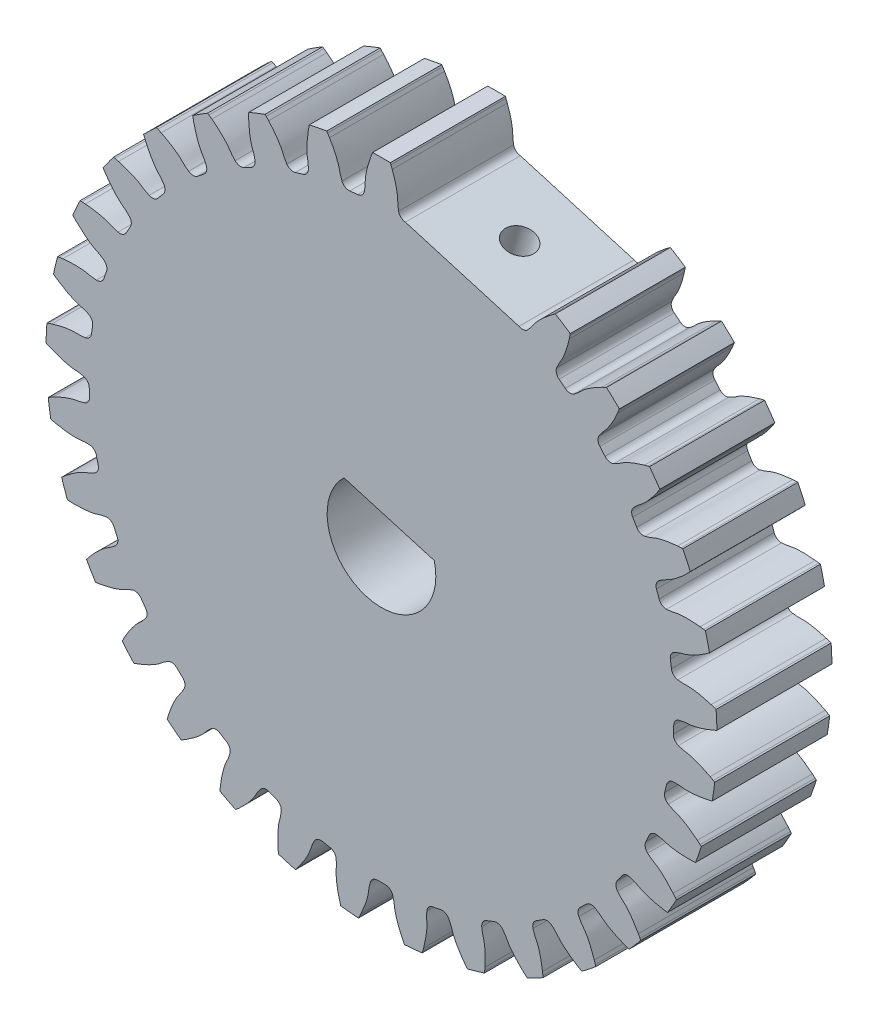
from build123d import *

# Parameters (mm, degrees)
BOSS_EXTRUDE1_DEPTH = 6.35
CUT_EXTRUDE1_REACH  = 43.23
SKETCH2_R           = 0.80645


with BuildPart() as part:
    # Sketch1 → Boss-Extrude1 (new body)
    with BuildSketch(Plane.XY):
        with BuildLine():
            Line((1.317722718, 16.087824145), (7.589195505, 14.246353585))
            ThreePointArc((7.589195505, 14.246353585), (7.848909294, 14.203144005), (8.081908957, 14.325738774))
            add(Edge.make_bspline(
                [(8.081908957, 14.325738774), (8.135763516, 14.382193351), (8.188276052, 14.439723268), (8.286040148, 14.560601191), (8.329833372, 14.625117736), (8.41657454, 14.754828132), (8.460564791, 14.819186802), (8.558645399, 14.93981111), (8.611251956, 14.997265689), (8.880827661, 15.279295862), (9.114602467, 15.484439301), (9.364156602, 15.671733637)],
                knots=[0, 0, 0, 0, 0.125, 0.125, 0.25, 0.25, 0.375, 0.375, 0.5, 0.5, 1, 1, 1, 1], degree=3))
            add(Edge.make_bspline(
                [(9.524985691, 15.789047753), (9.480902248, 15.75776951), (9.422419075, 15.715460547), (9.364156602, 15.671733637)],
                knots=[0.5, 0.5, 0.5, 0.5, 1, 1, 1, 1], degree=3))
            add(Edge.make_bspline(
                [(9.597666219, 15.840014852), (9.569069134, 15.820325996), (9.524985691, 15.789047753)],
                knots=[0, 0, 0, 0.5, 0.5, 0.5], degree=2))
            ThreePointArc((9.597666219, 15.840014852), (10.013118473, 15.580716473), (10.421569679, 15.310524249))
            add(Edge.make_bspline(
                [(10.421569679, 15.310524249), (10.415539725, 15.276332379), (10.405400958, 15.223239217)],
                knots=[0, 0, 0, 0.5, 0.5, 0.5], degree=2))
            add(Edge.make_bspline(
                [(10.405400958, 15.223239217), (10.395262191, 15.170146055), (10.381071393, 15.099372112), (10.365499102, 15.028209887)],
                knots=[0.5, 0.5, 0.5, 0.5, 1, 1, 1, 1], degree=3))
            add(Edge.make_bspline(
                [(10.365499102, 15.028209887), (10.298797583, 14.723397404), (10.209249565, 14.425372226), (10.064716198, 14.063080733), (10.034311357, 13.991375238), (9.965335513, 13.852067605), (9.925065558, 13.785319161), (9.843110552, 13.652533336), (9.802619615, 13.585895932), (9.733288872, 13.44676663), (9.702778631, 13.375114097), (9.673804032, 13.30268993)],
                knots=[0, 0, 0, 0, 0.5, 0.5, 0.625, 0.625, 0.75, 0.75, 0.875, 0.875, 1, 1, 1, 1], degree=3))
            ThreePointArc((9.673804032, 13.30268993), (9.659079466, 13.039818274), (9.806273289, 12.82152421))
            ThreePointArc((9.806273289, 12.82152421), (9.978136908, 12.68823324), (10.148188999, 12.552638724))
            ThreePointArc((10.148188999, 12.552638724), (10.395031955, 12.46105884), (10.647022223, 12.537342685))
            add(Edge.make_bspline(
                [(10.647022223, 12.537342685), (10.710587659, 12.582585012), (10.773038833, 12.629137225), (10.891912502, 12.729328749), (10.947124161, 12.784391475), (11.056845658, 12.895341961), (11.112220906, 12.950212376), (11.23135737, 13.050094969), (11.293886608, 13.096555413), (11.61196529, 13.322471395), (11.880339132, 13.479665452), (12.160829185, 13.616346705)],
                knots=[0, 0, 0, 0, 0.125, 0.125, 0.25, 0.25, 0.375, 0.375, 0.5, 0.5, 1, 1, 1, 1], degree=3))
            add(Edge.make_bspline(
                [(12.340953725, 13.701103697), (12.291747481, 13.678733539), (12.226314152, 13.648257167), (12.160829185, 13.616346705)],
                knots=[0.5, 0.5, 0.5, 0.5, 1, 1, 1, 1], degree=3))
            add(Edge.make_bspline(
                [(12.421966409, 13.737394873), (12.39015997, 13.723473855), (12.340953725, 13.701103697)],
                knots=[0, 0, 0, 0.5, 0.5, 0.5], degree=2))
            ThreePointArc((12.421966409, 13.737394873), (12.780838358, 13.404157497), (13.130774104, 13.061548101))
            add(Edge.make_bspline(
                [(13.130774104, 13.061548101), (13.118382265, 13.029115299), (13.098378772, 12.978900373)],
                knots=[0, 0, 0, 0.5, 0.5, 0.5], degree=2))
            add(Edge.make_bspline(
                [(13.098378772, 12.978900373), (13.078375279, 12.928685448), (13.05104687, 12.861876109), (13.022288452, 12.794946953)],
                knots=[0.5, 0.5, 0.5, 0.5, 1, 1, 1, 1], degree=3))
            add(Edge.make_bspline(
                [(13.022288452, 12.794946953), (12.899106174, 12.508266174), (12.754774769, 12.232573774), (12.544289193, 11.904182479), (12.500863453, 11.839526949), (12.40676995, 11.715790551), (12.354595499, 11.657869478), (12.248991644, 11.542993353), (12.19662122, 11.485223133), (12.102212979, 11.361729009), (12.058693767, 11.297145431), (12.016536413, 11.231513542)],
                knots=[0, 0, 0, 0, 0.5, 0.5, 0.625, 0.625, 0.75, 0.75, 0.875, 0.875, 1, 1, 1, 1], degree=3))
            ThreePointArc((12.016536413, 11.231513542), (11.952329151, 10.976178962), (12.055550567, 10.733973142))
            ThreePointArc((12.055550567, 10.733973142), (12.199082904, 10.570565509), (12.340400502, 10.405238793))
            ThreePointArc((12.340400502, 10.405238793), (12.565451077, 10.26859854), (12.827324365, 10.295814365))
            add(Edge.make_bspline(
                [(12.827324365, 10.295814365), (12.898303258, 10.328209266), (12.968435922, 10.362101258), (13.10412276, 10.437985201), (13.168757362, 10.481603996), (13.297493565, 10.569784533), (13.362252405, 10.613183534), (13.498138823, 10.688714394), (13.568330773, 10.722501501), (13.92341624, 10.8841381), (14.216689388, 10.987701373), (14.517977717, 11.068829526)],
                knots=[0, 0, 0, 0, 0.125, 0.125, 0.25, 0.25, 0.375, 0.375, 0.5, 0.5, 1, 1, 1, 1], degree=3))
            add(Edge.make_bspline(
                [(14.710887538, 11.117966055), (14.658336935, 11.105312498), (14.58831838, 11.087770213), (14.517977717, 11.068829526)],
                knots=[0.5, 0.5, 0.5, 0.5, 1, 1, 1, 1], degree=3))
            add(Edge.make_bspline(
                [(14.797304367, 11.138269651), (14.763438142, 11.130619612), (14.710887538, 11.117966055)],
                knots=[0, 0, 0, 0.5, 0.5, 0.5], degree=2))
            ThreePointArc((14.797304367, 11.138269651), (15.086625445, 10.743137346), (15.365398141, 10.340493572))
            add(Edge.make_bspline(
                [(15.365398141, 10.340493572), (15.347092291, 10.310992044), (15.31794705, 10.265470254)],
                knots=[0, 0, 0, 0.5, 0.5, 0.5], degree=2))
            add(Edge.make_bspline(
                [(15.31794705, 10.265470254), (15.288801809, 10.219948464), (15.24932351, 10.159518391), (15.208418367, 10.0992413)],
                knots=[0.5, 0.5, 0.5, 0.5, 1, 1, 1, 1], degree=3))
            add(Edge.make_bspline(
                [(15.208418367, 10.0992413), (15.03320746, 9.841053615), (14.839309181, 9.597658233), (14.570478893, 9.315036054), (14.515601773, 9.259767309), (14.399791394, 9.156074302), (14.337598169, 9.109074018), (14.212162263, 9.016259514), (14.149805155, 8.969444446), (14.033731578, 8.866048899), (13.978776292, 8.810868495), (13.924959859, 8.754400992)],
                knots=[0, 0, 0, 0, 0.5, 0.5, 0.625, 0.625, 0.75, 0.75, 0.875, 0.875, 1, 1, 1, 1], degree=3))
            ThreePointArc((13.924959859, 8.754400992), (13.813590519, 8.515831944), (13.869108836, 8.258468317))
            ThreePointArc((13.869108836, 8.258468317), (13.97912226, 8.070849999), (14.086597777, 7.881766421))
            ThreePointArc((14.086597777, 7.881766421), (14.281722058, 7.705004334), (14.544013583, 7.682168489))
            add(Edge.make_bspline(
                [(14.544013583, 7.682168489), (14.619840571, 7.700545128), (14.695119948, 7.720551954), (14.842715878, 7.769385672), (14.91443736, 7.79998404), (15.057535409, 7.862207553), (15.129337287, 7.892566586), (15.277062369, 7.941015831), (15.352380112, 7.960908447), (15.731638649, 8.052423697), (16.039211447, 8.098613138), (16.350408708, 8.121256008)],
                knots=[0, 0, 0, 0, 0.125, 0.125, 0.25, 0.25, 0.375, 0.375, 0.5, 0.5, 1, 1, 1, 1], degree=3))
            add(Edge.make_bspline(
                [(16.549131547, 8.132996152), (16.495135899, 8.130516528), (16.423062772, 8.126542354), (16.350408708, 8.121256008)],
                knots=[0.5, 0.5, 0.5, 0.5, 1, 1, 1, 1], degree=3))
            add(Edge.make_bspline(
                [(16.637829192, 8.136578344), (16.603127194, 8.135475776), (16.549131547, 8.132996152)],
                knots=[0, 0, 0, 0.5, 0.5, 0.5], degree=2))
            ThreePointArc((16.637829192, 8.136578344), (16.847142581, 7.69383222), (17.044676656, 7.245706664))
            add(Edge.make_bspline(
                [(17.044676656, 7.245706664), (17.021118415, 7.220202672), (16.983884811, 7.181019293)],
                knots=[0, 0, 0, 0.5, 0.5, 0.5], degree=2))
            add(Edge.make_bspline(
                [(16.983884811, 7.181019293), (16.946651207, 7.141835914), (16.896449866, 7.089969209), (16.844876418, 7.038522752)],
                knots=[0.5, 0.5, 0.5, 0.5, 1, 1, 1, 1], degree=3))
            add(Edge.make_bspline(
                [(16.844876418, 7.038522752), (16.623969459, 6.818159737), (16.387512296, 6.615858318), (16.070053522, 6.389219956), (16.005708425, 6.345335553), (15.87236686, 6.265433671), (15.802402685, 6.231052889), (15.661668309, 6.163654566), (15.591578265, 6.129486667), (15.458034552, 6.049926681), (15.39362942, 6.006143816), (15.330098975, 5.96088158)],
                knots=[0, 0, 0, 0, 0.5, 0.5, 0.625, 0.625, 0.75, 0.75, 0.875, 0.875, 1, 1, 1, 1], degree=3))
            ThreePointArc((15.330098975, 5.96088158), (15.175592735, 5.747700572), (15.181401378, 5.484480931))
            ThreePointArc((15.181401378, 5.484480931), (15.253919716, 5.279432943), (15.323668708, 5.073426476))
            ThreePointArc((15.323668708, 5.073426476), (15.481814393, 4.862931198), (15.735044257, 4.790869028))
            add(Edge.make_bspline(
                [(15.735044257, 4.790869028), (15.812978754, 4.794563226), (15.890684051, 4.799961786), (16.044854573, 4.819980302), (16.121070733, 4.836452338), (16.273358691, 4.870469907), (16.349608501, 4.886691718), (16.503833078, 4.906308266), (16.581554433, 4.911587421), (16.971278649, 4.92967372), (17.282034615, 4.916819923), (17.591893328, 4.880159138)],
                knots=[0, 0, 0, 0, 0.125, 0.125, 0.25, 0.25, 0.375, 0.375, 0.5, 0.5, 1, 1, 1, 1], degree=3))
            add(Edge.make_bspline(
                [(17.789246823, 4.854078578), (17.735757675, 4.861862508), (17.664234886, 4.871600081), (17.591893328, 4.880159138)],
                knots=[0.5, 0.5, 0.5, 0.5, 1, 1, 1, 1], degree=3))
            add(Edge.make_bspline(
                [(17.87701952, 4.840809895), (17.84273597, 4.846294649), (17.789246823, 4.854078578)],
                knots=[0, 0, 0, 0.5, 0.5, 0.5], degree=2))
            ThreePointArc((17.87701952, 4.840809895), (17.998760088, 4.366451951), (18.107916146, 3.889041039))
            add(Edge.make_bspline(
                [(18.107916146, 3.889041039), (18.079956971, 3.868456363), (18.035980724, 3.837027585)],
                knots=[0, 0, 0, 0.5, 0.5, 0.5], degree=2))
            add(Edge.make_bspline(
                [(18.035980724, 3.837027585), (17.992004477, 3.805598806), (17.9328945, 3.764170067), (17.872516746, 3.723413653)],
                knots=[0.5, 0.5, 0.5, 0.5, 1, 1, 1, 1], degree=3))
            add(Edge.make_bspline(
                [(17.872516746, 3.723413653), (17.613897889, 3.548839802), (17.34342802, 3.394944045), (16.988814547, 3.232480802), (16.917327071, 3.201566837), (16.771273632, 3.148343943), (16.696067195, 3.127825274), (16.545120856, 3.088279082), (16.469831113, 3.06799327), (16.323643883, 3.01514435), (16.252116674, 2.984341449), (16.181168372, 2.951920377)],
                knots=[0, 0, 0, 0, 0.5, 0.5, 0.625, 0.625, 0.75, 0.75, 0.875, 0.875, 1, 1, 1, 1], degree=3))
            ThreePointArc((16.181168372, 2.951920377), (15.98910949, 2.771832327), (15.944998519, 2.512270114))
            ThreePointArc((15.944998519, 2.512270114), (15.977400768, 2.297203425), (16.006902326, 2.08171968))
            ThreePointArc((16.006902326, 2.08171968), (16.122353619, 1.845099057), (16.357369434, 1.726415078))
            add(Edge.make_bspline(
                [(16.357369434, 1.726415078), (16.434594684, 1.715293316), (16.51191743, 1.705888493), (16.667090418, 1.696368285), (16.745046606, 1.698118647), (16.90102039, 1.702700789), (16.978962264, 1.704199079), (17.134112258, 1.694273938), (17.211428174, 1.684748828), (17.597532421, 1.628752491), (17.900240025, 1.557320026), (18.197561087, 1.462680602)],
                knots=[0, 0, 0, 0, 0.125, 0.125, 0.25, 0.25, 0.375, 0.375, 0.5, 0.5, 1, 1, 1, 1], degree=3))
            add(Edge.make_bspline(
                [(18.386412369, 1.399721958), (18.335362958, 1.417488109), (18.266975527, 1.440585489), (18.197561087, 1.462680602)],
                knots=[0.5, 0.5, 0.5, 0.5, 1, 1, 1, 1], degree=3))
            add(Edge.make_bspline(
                [(18.470087785, 1.370081964), (18.437461779, 1.381955806), (18.386412369, 1.399721958)],
                knots=[0, 0, 0, 0.5, 0.5, 0.5], degree=2))
            ThreePointArc((18.470087785, 1.370081964), (18.499855511, 0.881256733), (18.516688368, 0.391815337))
            add(Edge.make_bspline(
                [(18.516688368, 0.391815337), (18.485338776, 0.376893962), (18.436209301, 0.354355702)],
                knots=[0, 0, 0, 0.5, 0.5, 0.5], degree=2))
            add(Edge.make_bspline(
                [(18.436209301, 0.354355702), (18.387079826, 0.331817442), (18.321197604, 0.302324011), (18.254197752, 0.273730684)],
                knots=[0.5, 0.5, 0.5, 0.5, 1, 1, 1, 1], degree=3))
            add(Edge.make_bspline(
                [(18.254197752, 0.273730684), (17.967214156, 0.15125555), (17.672507066, 0.051327649), (17.29355555, -0.041088631), (17.21750944, -0.057914846), (17.064022878, -0.082535137), (16.986292335, -0.088450096), (16.830589627, -0.098714854), (16.752821353, -0.104385398), (16.599274193, -0.128613154), (16.523210086, -0.145322792), (16.447408185, -0.163730919)],
                knots=[0, 0, 0, 0, 0.5, 0.5, 0.625, 0.625, 0.75, 0.75, 0.875, 0.875, 1, 1, 1, 1], degree=3))
            ThreePointArc((16.447408185, -0.163730919), (16.224738169, -0.304217162), (16.132301868, -0.550740691))
            ThreePointArc((16.132301868, -0.550740691), (16.123416929, -0.768053011), (16.111604787, -0.985225891))
            ThreePointArc((16.111604787, -0.985225891), (16.180188978, -1.239419771), (16.38849666, -1.400436011))
            add(Edge.make_bspline(
                [(16.38849666, -1.400436011), (16.462221543, -1.425971763), (16.536367091, -1.449840055), (16.686934191, -1.488554901), (16.763812867, -1.501589477), (16.917835177, -1.526608372), (16.994652093, -1.539887755), (17.14511998, -1.578995865), (17.219236057, -1.602980977), (17.58776552, -1.731036096), (17.871484121, -1.858465475), (18.145521576, -2.007663022)],
                knots=[0, 0, 0, 0, 0.125, 0.125, 0.25, 0.25, 0.375, 0.375, 0.5, 0.5, 1, 1, 1, 1], degree=3))
            add(Edge.make_bspline(
                [(18.319045067, -2.105224262), (18.272280452, -2.078118003), (18.209500078, -2.042495617), (18.145521576, -2.007663022)],
                knots=[0.5, 0.5, 0.5, 0.5, 1, 1, 1, 1], degree=3))
            add(Edge.make_bspline(
                [(18.395598953, -2.150164298), (18.365809682, -2.13233052), (18.319045067, -2.105224262)],
                knots=[0, 0, 0, 0.5, 0.5, 0.5], degree=2))
            ThreePointArc((18.395598953, -2.150164298), (18.332317955, -2.635789401), (18.256219227, -3.119571591))
            add(Edge.make_bspline(
                [(18.256219227, -3.119571591), (18.222612274, -3.128290368), (18.170105239, -3.141123518)],
                knots=[0, 0, 0, 0.5, 0.5, 0.5], degree=2))
            add(Edge.make_bspline(
                [(18.170105239, -3.141123518), (18.117598204, -3.153956668), (18.047324891, -3.170448823), (17.976124491, -3.185845626)],
                knots=[0.5, 0.5, 0.5, 0.5, 1, 1, 1, 1], degree=3))
            add(Edge.make_bspline(
                [(17.976124491, -3.185845626), (17.671148491, -3.251795471), (17.362855663, -3.294143862), (16.973262398, -3.313173013), (16.895406158, -3.315303336), (16.740033877, -3.310431183), (16.662588613, -3.301528649), (16.507757038, -3.282140979), (16.43032098, -3.272991305), (16.274963484, -3.267722243), (16.197111635, -3.26973469), (16.119195812, -3.273464554)],
                knots=[0, 0, 0, 0, 0.5, 0.5, 0.625, 0.625, 0.75, 0.75, 0.875, 0.875, 1, 1, 1, 1], degree=3))
            ThreePointArc((16.119195812, -3.273464554), (15.873962538, -3.36927145), (15.736541797, -3.593846292))
            ThreePointArc((15.736541797, -3.593846292), (15.686690793, -3.80555001), (15.633991875, -4.016562831))
            ThreePointArc((15.633991875, -4.016562831), (15.653230151, -4.27914274), (15.827300918, -4.476671694))
            add(Edge.make_bspline(
                [(15.827300918, -4.476671694), (15.894860823, -4.515698508), (15.963149361, -4.553167606), (16.103668684, -4.619677835), (16.176691252, -4.647026244), (16.323195322, -4.70074193), (16.396110916, -4.728319033), (16.536458394, -4.795196644), (16.604695885, -4.832774874), (16.94233095, -5.028260529), (17.196806217, -5.207081191), (17.437655637, -5.405444474)],
                knots=[0, 0, 0, 0, 0.125, 0.125, 0.25, 0.25, 0.375, 0.375, 0.5, 0.5, 1, 1, 1, 1], degree=3))
            add(Edge.make_bspline(
                [(17.589579747, -5.534082191), (17.548790122, -5.498615517), (17.493885853, -5.451755609), (17.437655637, -5.405444474)],
                knots=[0.5, 0.5, 0.5, 0.5, 1, 1, 1, 1], degree=3))
            add(Edge.make_bspline(
                [(17.656245247, -5.592698021), (17.630369371, -5.569548866), (17.589579747, -5.534082191)],
                knots=[0, 0, 0, 0.5, 0.5, 0.5], degree=2))
            ThreePointArc((17.656245247, -5.592698021), (17.502202663, -6.057571237), (17.335922757, -6.518209075))
            add(Edge.make_bspline(
                [(17.335922757, -6.518209075), (17.301273086, -6.520410135), (17.247286232, -6.523074351)],
                knots=[0, 0, 0, 0.5, 0.5, 0.5], degree=2))
            add(Edge.make_bspline(
                [(17.247286232, -6.523074351), (17.193299378, -6.525738568), (17.121174834, -6.528633375), (17.048347254, -6.530277174)],
                knots=[0.5, 0.5, 0.5, 0.5, 1, 1, 1, 1], degree=3))
            add(Edge.make_bspline(
                [(17.048347254, -6.530277174), (16.736401478, -6.537318132), (16.425665417, -6.52055643), (16.039511319, -6.46551069), (15.962658877, -6.452868125), (15.811016436, -6.418679621), (15.736655525, -6.395281354), (15.588291099, -6.346941976), (15.513985998, -6.323302779), (15.362433191, -6.288727336), (15.285607368, -6.275969856), (15.208393704, -6.26488665)],
                knots=[0, 0, 0, 0, 0.5, 0.5, 0.625, 0.625, 0.75, 0.75, 0.875, 0.875, 1, 1, 1, 1], degree=3))
            ThreePointArc((15.208393704, -6.26488665), (14.94946054, -6.312551488), (14.772022103, -6.507060925))
            ThreePointArc((14.772022103, -6.507060925), (14.683006779, -6.705504515), (14.59132576, -6.902730723))
            ThreePointArc((14.59132576, -6.902730723), (14.560522802, -7.164206339), (14.694065283, -7.391108799))
            add(Edge.make_bspline(
                [(14.694065283, -7.391108799), (14.753018419, -7.442216143), (14.812981821, -7.491931816), (14.938374633, -7.583833575), (15.004901868, -7.624507375), (15.138592658, -7.704978426), (15.204971572, -7.745856542), (15.330126116, -7.838086522), (15.39001874, -7.887899694), (15.684556396, -8.143750526), (15.900590931, -8.367499426), (16.09954739, -8.607859078)],
                knots=[0, 0, 0, 0, 0.125, 0.125, 0.25, 0.25, 0.375, 0.375, 0.5, 0.5, 1, 1, 1, 1], degree=3))
            add(Edge.make_bspline(
                [(16.224381185, -8.762923971), (16.191040795, -8.720378739), (16.145997012, -8.66397495), (16.09954739, -8.607859078)],
                knots=[0.5, 0.5, 0.5, 0.5, 1, 1, 1, 1], degree=3))
            add(Edge.make_bspline(
                [(16.278748834, -8.833097066), (16.257721575, -8.805469204), (16.224381185, -8.762923971)],
                knots=[0, 0, 0, 0.5, 0.5, 0.5], degree=2))
            ThreePointArc((16.278748834, -8.833097066), (16.039512166, -9.260416667), (15.78906087, -9.681261499))
            add(Edge.make_bspline(
                [(15.78906087, -9.681261499), (15.754620811, -9.67686529), (15.701105363, -9.669264281)],
                knots=[0, 0, 0, 0.5, 0.5, 0.5], degree=2))
            add(Edge.make_bspline(
                [(15.701105363, -9.669264281), (15.647589916, -9.661663272), (15.57622091, -9.650856107), (15.504398329, -9.63868749)],
                knots=[0.5, 0.5, 0.5, 0.5, 1, 1, 1, 1], degree=3))
            add(Edge.make_bspline(
                [(15.504398329, -9.63868749), (15.196757308, -9.586565083), (14.894808826, -9.511299101), (14.526050511, -9.384167965), (14.452979513, -9.357209447), (14.310547666, -9.294940254), (14.241958704, -9.257891929), (14.105423704, -9.182347954), (14.036935141, -9.145073616), (13.894664536, -9.082441439), (13.821641425, -9.05537512), (13.747920623, -9.02987942)],
                knots=[0, 0, 0, 0, 0.5, 0.5, 0.625, 0.625, 0.75, 0.75, 0.875, 0.875, 1, 1, 1, 1], degree=3))
            ThreePointArc((13.747920623, -9.02987942), (13.484646089, -9.027679469), (13.273603043, -9.185093422))
            ThreePointArc((13.273603043, -9.185093422), (13.148640646, -9.363104618), (13.021291117, -9.539415945))
            ThreePointArc((13.021291117, -9.539415945), (12.941560222, -9.790336857), (13.029747843, -10.038411973))
            add(Edge.make_bspline(
                [(13.029747843, -10.038411973), (13.077963491, -10.099752695), (13.127434523, -10.15991809), (13.233168801, -10.273889811), (13.290796236, -10.326418944), (13.406841812, -10.430736926), (13.464284938, -10.483438614), (13.569723138, -10.597687531), (13.61910622, -10.657935268), (13.859901109, -10.96490416), (14.02968686, -11.225494431), (14.179559553, -11.499163228)],
                knots=[0, 0, 0, 0, 0.125, 0.125, 0.25, 0.25, 0.375, 0.375, 0.5, 0.5, 1, 1, 1, 1], degree=3))
            add(Edge.make_bspline(
                [(14.272791215, -11.675050848), (14.248105067, -11.626964752), (14.214549772, -11.563055661), (14.179559553, -11.499163228)],
                knots=[0.5, 0.5, 0.5, 0.5, 1, 1, 1, 1], degree=3))
            add(Edge.make_bspline(
                [(14.312896024, -11.754244968), (14.297477363, -11.723136943), (14.272791215, -11.675050848)],
                knots=[0, 0, 0, 0.5, 0.5, 0.5], degree=2))
            ThreePointArc((14.312896024, -11.754244968), (13.997111908, -12.12856651), (13.671541185, -12.494407908))
            add(Edge.make_bspline(
                [(13.671541185, -12.494407908), (13.638555491, -12.48357332), (13.587445638, -12.465981807)],
                knots=[0, 0, 0, 0.5, 0.5, 0.5], degree=2))
            add(Edge.make_bspline(
                [(13.587445638, -12.465981807), (13.536335784, -12.448390293), (13.468301779, -12.424271754), (13.400080051, -12.398730527)],
                knots=[0.5, 0.5, 0.5, 0.5, 1, 1, 1, 1], degree=3))
            add(Edge.make_bspline(
                [(13.400080051, -12.398730527), (13.107862735, -12.289328594), (12.825615036, -12.15827864), (12.48758039, -11.96365696), (12.420931814, -11.92335684), (12.292858418, -11.835257528), (12.232520389, -11.785898168), (12.112749546, -11.685879953), (12.052552875, -11.636317664), (11.924706503, -11.547892443), (11.858125349, -11.507495534), (11.790561871, -11.468508821)],
                knots=[0, 0, 0, 0, 0.5, 0.5, 0.625, 0.625, 0.75, 0.75, 0.875, 0.875, 1, 1, 1, 1], degree=3))
            ThreePointArc((11.790561871, -11.468508821), (11.532461394, -11.416523592), (11.295441383, -11.53115271))
            ThreePointArc((11.295441383, -11.53115271), (11.139048379, -11.682297722), (10.980633084, -11.831321816))
            ThreePointArc((10.980633084, -11.831321816), (10.854855936, -12.062619091), (10.894501368, -12.322900785))
            add(Edge.make_bspline(
                [(10.894501368, -12.322900785), (10.930236888, -12.392257871), (10.967427539, -12.460698453), (11.049681771, -12.5926209), (11.096326598, -12.655106827), (11.190532772, -12.779501417), (11.236963966, -12.8421219), (11.318875011, -12.974260501), (11.355963716, -13.042765293), (11.534312883, -13.389757589), (11.651713352, -13.677770819), (11.74708549, -13.974857658)],
                knots=[0, 0, 0, 0, 0.125, 0.125, 0.25, 0.25, 0.375, 0.375, 0.5, 0.5, 1, 1, 1, 1], degree=3))
            add(Edge.make_bspline(
                [(11.805345383, -14.165210967), (11.790205699, -14.113321966), (11.769351667, -14.044217414), (11.74708549, -13.974857658)],
                knots=[0.5, 0.5, 0.5, 0.5, 1, 1, 1, 1], degree=3))
            add(Edge.make_bspline(
                [(11.82973786, -14.250563832), (11.820485067, -14.217099968), (11.805345383, -14.165210967)],
                knots=[0, 0, 0, 0.5, 0.5, 0.5], degree=2))
            ThreePointArc((11.82973786, -14.250563832), (11.448819557, -14.558358359), (11.059896381, -14.855973862))
            add(Edge.make_bspline(
                [(11.059896381, -14.855973862), (11.029557241, -14.839092485), (10.982700225, -14.81214627)],
                knots=[0, 0, 0, 0.5, 0.5, 0.5], degree=2))
            add(Edge.make_bspline(
                [(10.982700225, -14.81214627), (10.935843209, -14.785200055), (10.873603131, -14.748641849), (10.811447967, -14.710651138)],
                knots=[0.5, 0.5, 0.5, 0.5, 1, 1, 1, 1], degree=3))
            add(Edge.make_bspline(
                [(10.811447967, -14.710651138), (10.545215851, -14.54792375), (10.292870102, -14.365826311), (9.997776578, -14.110748221), (9.939959276, -14.058563051), (9.830873237, -13.947817758), (9.780966916, -13.88793134), (9.682289059, -13.767053803), (9.632559946, -13.706994874), (9.523758507, -13.595972527), (9.466025727, -13.543705077), (9.407061492, -13.492636432)],
                knots=[0, 0, 0, 0, 0.5, 0.5, 0.625, 0.625, 0.75, 0.75, 0.875, 0.875, 1, 1, 1, 1], degree=3))
            ThreePointArc((9.407061492, -13.492636432), (9.163463497, -13.392744808), (8.909033044, -13.460446097))
            ThreePointArc((8.909033044, -13.460446097), (8.726861883, -13.579262151), (8.543106363, -13.695612895))
            ThreePointArc((8.543106363, -13.695612895), (8.375828875, -13.898926844), (8.365499228, -14.162007855))
            add(Edge.make_bspline(
                [(8.365499228, -14.162007855), (8.387463046, -14.23687456), (8.411029148, -14.311116708), (8.466830451, -14.456221861), (8.500806807, -14.526406177), (8.569768721, -14.666381431), (8.603509838, -14.736657441), (8.658933249, -14.881909892), (8.682387097, -14.956195797), (8.791844538, -15.330670292), (8.852616565, -15.635696932), (8.89004115, -15.945464321)],
                knots=[0, 0, 0, 0, 0.125, 0.125, 0.25, 0.25, 0.375, 0.375, 0.5, 0.5, 1, 1, 1, 1], degree=3))
            add(Edge.make_bspline(
                [(8.91122361, -16.143403455), (8.906177579, -16.089586952), (8.898778528, -16.017784558), (8.89004115, -15.945464321)],
                knots=[0.5, 0.5, 0.5, 0.5, 1, 1, 1, 1], degree=3))
            add(Edge.make_bspline(
                [(8.919022148, -16.231830189), (8.916269642, -16.197219959), (8.91122361, -16.143403455)],
                knots=[0, 0, 0, 0.5, 0.5, 0.5], degree=2))
            ThreePointArc((8.919022148, -16.231830189), (8.486737038, -16.461973205), (8.048518106, -16.680606214))
            add(Edge.make_bspline(
                [(8.048518106, -16.680606214), (8.021922055, -16.658288185), (7.981011411, -16.622961175)],
                knots=[0, 0, 0, 0.5, 0.5, 0.5], degree=2))
            add(Edge.make_bspline(
                [(7.981011411, -16.622961175), (7.940100767, -16.587634164), (7.885904134, -16.539957601), (7.832061985, -16.490890489)],
                knots=[0.5, 0.5, 0.5, 0.5, 1, 1, 1, 1], degree=3))
            add(Edge.make_bspline(
                [(7.832061985, -16.490890489), (7.60143739, -16.280719037), (7.388114025, -16.05415559), (7.146627071, -15.747840276), (7.099730711, -15.685656164), (7.013574684, -15.556267514), (6.975903814, -15.488018488), (6.901885419, -15.350650458), (6.864421203, -15.282265577), (6.778597065, -15.15265874), (6.731799271, -15.09040983), (6.683565402, -15.029105007)],
                knots=[0, 0, 0, 0, 0.5, 0.5, 0.625, 0.625, 0.75, 0.75, 0.875, 0.875, 1, 1, 1, 1], degree=3))
            ThreePointArc((6.683565402, -15.029105007), (6.463274153, -14.884917331), (6.200629036, -14.903243889))
            ThreePointArc((6.200629036, -14.903243889), (5.99926386, -14.985436664), (5.79680952, -15.064908837))
            ThreePointArc((5.79680952, -15.064908837), (5.594077536, -15.232891165), (5.53414615, -15.489263062))
            add(Edge.make_bspline(
                [(5.53414615, -15.489263062), (5.541544436, -15.566933508), (5.550634248, -15.644293918), (5.577965819, -15.797337298), (5.598045708, -15.87268336), (5.6392709, -16.023180206), (5.659102449, -16.098571786), (5.68603508, -16.251688286), (5.695006385, -16.329070417), (5.731616024, -16.717492627), (5.73356315, -17.02850822), (5.71168756, -17.339760358)],
                knots=[0, 0, 0, 0, 0.125, 0.125, 0.25, 0.25, 0.375, 0.375, 0.5, 0.5, 1, 1, 1, 1], degree=3))
            add(Edge.make_bspline(
                [(5.695026999, -17.538131281), (5.700256996, -17.484332345), (5.706580348, -17.412427234), (5.71168756, -17.339760358)],
                knots=[0.5, 0.5, 0.5, 0.5, 1, 1, 1, 1], degree=3))
            add(Edge.make_bspline(
                [(5.685949737, -17.626435912), (5.689797002, -17.591930218), (5.695026999, -17.538131281)],
                knots=[0, 0, 0, 0.5, 0.5, 0.5], degree=2))
            ThreePointArc((5.685949737, -17.626435912), (5.21792173, -17.770609449), (4.746245416, -17.902357996))
            add(Edge.make_bspline(
                [(4.746245416, -17.902357996), (4.724353705, -17.875409947), (4.69086805, -17.832978952)],
                knots=[0, 0, 0, 0.5, 0.5, 0.5], degree=2))
            add(Edge.make_bspline(
                [(4.69086805, -17.832978952), (4.657382396, -17.790547956), (4.613188015, -17.73347619), (4.569604876, -17.675106091)],
                knots=[0.5, 0.5, 0.5, 0.5, 1, 1, 1, 1], degree=3))
            add(Edge.make_bspline(
                [(4.569604876, -17.675106091), (4.382923177, -17.42508672), (4.216332257, -17.162245857), (4.037179841, -16.815764353), (4.00289938, -16.745828794), (3.942787268, -16.602473231), (3.918713373, -16.528328295), (3.872029657, -16.379434611), (3.848184392, -16.305195383), (3.788439463, -16.161688386), (3.75426805, -16.091707854), (3.718507844, -16.02238257)],
                knots=[0, 0, 0, 0, 0.5, 0.5, 0.625, 0.625, 0.75, 0.75, 0.875, 0.875, 1, 1, 1, 1], degree=3))
            ThreePointArc((3.718507844, -16.02238257), (3.529485242, -15.839110161), (3.268118142, -15.80739962))
            ThreePointArc((3.268118142, -15.80739962), (3.054836811, -15.849998454), (2.841000876, -15.889719726))
            ThreePointArc((2.841000876, -15.889719726), (2.610141659, -16.016299114), (2.502774611, -16.256695945))
            add(Edge.make_bspline(
                [(2.502774611, -16.256695945), (2.495339971, -16.33436292), (2.489624965, -16.412045585), (2.487498969, -16.567495805), (2.492956652, -16.64528041), (2.504955136, -16.800859501), (2.510160353, -16.878641802), (2.507628787, -17.034088321), (2.501793305, -17.111769887), (2.464231974, -17.500101221), (2.407283824, -17.805864854), (2.326898701, -18.107352277)],
                knots=[0, 0, 0, 0, 0.125, 0.125, 0.25, 0.25, 0.375, 0.375, 0.5, 0.5, 1, 1, 1, 1], degree=3))
            add(Edge.make_bspline(
                [(2.272997273, -18.298985348), (2.288314273, -18.247148411), (2.308131486, -18.177739422), (2.326898701, -18.107352277)],
                knots=[0.5, 0.5, 0.5, 0.5, 1, 1, 1, 1], degree=3))
            add(Edge.make_bspline(
                [(2.247372288, -18.383976315), (2.257680273, -18.350822284), (2.272997273, -18.298985348)],
                knots=[0, 0, 0, 0.5, 0.5, 0.5], degree=2))
            ThreePointArc((2.247372288, -18.383976315), (1.760517135, -18.436969566), (1.272431051, -18.477071916))
            add(Edge.make_bspline(
                [(1.272431051, -18.477071916), (1.256034903, -18.44646782), (1.231184496, -18.398466406)],
                knots=[0, 0, 0, 0.5, 0.5, 0.5], degree=2))
            add(Edge.make_bspline(
                [(1.231184496, -18.398466406), (1.20633409, -18.350464992), (1.173739262, -18.286060746), (1.141990341, -18.220497307)],
                knots=[0.5, 0.5, 0.5, 0.5, 1, 1, 1, 1], degree=3))
            add(Edge.make_bspline(
                [(1.141990341, -18.220497307), (1.005998701, -17.939666368), (0.892161256, -17.650047842), (0.781818413, -17.275922893), (0.761392837, -17.200763541), (0.729497247, -17.048622308), (0.71989042, -16.971261252), (0.702228655, -16.81622332), (0.692864171, -16.738812946), (0.661357789, -16.586592505), (0.641047801, -16.51140963), (0.619053724, -16.436569481)],
                knots=[0, 0, 0, 0, 0.5, 0.5, 0.625, 0.625, 0.75, 0.75, 0.875, 0.875, 1, 1, 1, 1], degree=3))
            ThreePointArc((0.619053724, -16.436569481), (0.468131539, -16.22083628), (0.217488941, -16.14023474))
            ThreePointArc((0.217488941, -16.14023474), (0, -16.141700001), (-0.217488941, -16.14023474))
            ThreePointArc((-0.217488941, -16.14023474), (-0.468131539, -16.22083628), (-0.619053724, -16.436569481))
            add(Edge.make_bspline(
                [(-0.619053724, -16.436569481), (-0.641052581, -16.511425898), (-0.661365851, -16.586623164), (-0.692872575, -16.738861848), (-0.702234352, -16.816273657), (-0.719896234, -16.971311959), (-0.729505479, -17.048673726), (-0.761409743, -17.200832022), (-0.781841103, -17.276005409), (-0.892215841, -17.650210561), (-1.006001011, -17.939671139), (-1.141990341, -18.220497307)],
                knots=[0, 0, 0, 0, 0.125, 0.125, 0.25, 0.25, 0.375, 0.375, 0.5, 0.5, 1, 1, 1, 1], degree=3))
            add(Edge.make_bspline(
                [(-1.231184496, -18.398466406), (-1.20633409, -18.350464992), (-1.173739262, -18.286060746), (-1.141990341, -18.220497307)],
                knots=[0.5, 0.5, 0.5, 0.5, 1, 1, 1, 1], degree=3))
            add(Edge.make_bspline(
                [(-1.272431051, -18.477071916), (-1.256034903, -18.44646782), (-1.231184496, -18.398466406)],
                knots=[0, 0, 0, 0.5, 0.5, 0.5], degree=2))
            ThreePointArc((-1.272431051, -18.477071916), (-1.760517135, -18.436969566), (-2.247372288, -18.383976315))
            add(Edge.make_bspline(
                [(-2.247372288, -18.383976315), (-2.257680273, -18.350822284), (-2.272997273, -18.298985348)],
                knots=[0, 0, 0, 0.5, 0.5, 0.5], degree=2))
            add(Edge.make_bspline(
                [(-2.272997273, -18.298985348), (-2.288314273, -18.247148411), (-2.308131486, -18.177739422), (-2.326898701, -18.107352277)],
                knots=[0.5, 0.5, 0.5, 0.5, 1, 1, 1, 1], degree=3))
            add(Edge.make_bspline(
                [(-2.326898701, -18.107352277), (-2.40728519, -17.805859732), (-2.464254777, -17.499931112), (-2.501799969, -17.111684568), (-2.507632428, -17.034017878), (-2.510158705, -16.878589754), (-2.504951248, -16.80080861), (-2.49295272, -16.645229904), (-2.487497966, -16.567446196), (-2.48962708, -16.412013955), (-2.495341587, -16.334346042), (-2.502774611, -16.256695945)],
                knots=[0, 0, 0, 0, 0.5, 0.5, 0.625, 0.625, 0.75, 0.75, 0.875, 0.875, 1, 1, 1, 1], degree=3))
            ThreePointArc((-2.502774611, -16.256695945), (-2.610141659, -16.016299113), (-2.841000876, -15.889719724))
            ThreePointArc((-2.841000876, -15.889719724), (-3.054836811, -15.849998453), (-3.26811814, -15.807399619))
            ThreePointArc((-3.26811814, -15.807399619), (-3.529485242, -15.839110161), (-3.718507844, -16.02238257))
            add(Edge.make_bspline(
                [(-3.718507844, -16.02238257), (-3.754275823, -16.091722923), (-3.788453182, -16.161716965), (-3.848201899, -16.305241811), (-3.872044778, -16.37948296), (-3.918728678, -16.528376985), (-3.942805082, -16.602522162), (-4.002928941, -16.745892838), (-4.037217737, -16.815841083), (-4.21641665, -17.162395305), (-4.382926349, -17.425090967), (-4.569604876, -17.675106091)],
                knots=[0, 0, 0, 0, 0.125, 0.125, 0.25, 0.25, 0.375, 0.375, 0.5, 0.5, 1, 1, 1, 1], degree=3))
            add(Edge.make_bspline(
                [(-4.69086805, -17.832978952), (-4.657382396, -17.790547956), (-4.613188015, -17.73347619), (-4.569604876, -17.675106091)],
                knots=[0.5, 0.5, 0.5, 0.5, 1, 1, 1, 1], degree=3))
            add(Edge.make_bspline(
                [(-4.746245416, -17.902357996), (-4.724353705, -17.875409947), (-4.69086805, -17.832978952)],
                knots=[0, 0, 0, 0.5, 0.5, 0.5], degree=2))
            ThreePointArc((-4.746245416, -17.902357996), (-5.21792173, -17.770609449), (-5.685949737, -17.626435912))
            add(Edge.make_bspline(
                [(-5.685949737, -17.626435912), (-5.689797002, -17.591930218), (-5.695026999, -17.538131281)],
                knots=[0, 0, 0, 0.5, 0.5, 0.5], degree=2))
            add(Edge.make_bspline(
                [(-5.695026999, -17.538131281), (-5.700256996, -17.484332345), (-5.706580348, -17.412427234), (-5.71168756, -17.339760358)],
                knots=[0.5, 0.5, 0.5, 0.5, 1, 1, 1, 1], degree=3))
            add(Edge.make_bspline(
                [(-5.71168756, -17.339760358), (-5.733563522, -17.028502932), (-5.731606222, -16.717321276), (-5.694996782, -16.328985379), (-5.686025323, -16.251618427), (-5.659090981, -16.098520991), (-5.639257451, -16.023130971), (-5.598032289, -15.872634511), (-5.577955446, -15.797288775), (-5.550630338, -15.64426246), (-5.541542828, -15.566916629), (-5.53414615, -15.489263062)],
                knots=[0, 0, 0, 0, 0.5, 0.5, 0.625, 0.625, 0.75, 0.75, 0.875, 0.875, 1, 1, 1, 1], degree=3))
            ThreePointArc((-5.53414615, -15.489263062), (-5.594077536, -15.232891166), (-5.79680952, -15.064908837))
            ThreePointArc((-5.79680952, -15.064908837), (-5.999263861, -14.985436664), (-6.200629037, -14.90324389))
            ThreePointArc((-6.200629037, -14.90324389), (-6.463274154, -14.884917331), (-6.683565402, -15.029105007))
            add(Edge.make_bspline(
                [(-6.683565402, -15.029105007), (-6.731809755, -15.090423155), (-6.778615944, -15.152684206), (-6.86444718, -15.282307852), (-6.901909416, -15.350695072), (-6.975928057, -15.488063402), (-7.013601437, -15.55631219), (-7.099771858, -15.685713456), (-7.146678803, -15.747908448), (-7.388225176, -16.054286366), (-7.601441308, -16.280722608), (-7.832061985, -16.490890489)],
                knots=[0, 0, 0, 0, 0.125, 0.125, 0.25, 0.25, 0.375, 0.375, 0.5, 0.5, 1, 1, 1, 1], degree=3))
            add(Edge.make_bspline(
                [(-7.981011411, -16.622961175), (-7.940100767, -16.587634164), (-7.885904134, -16.539957601), (-7.832061985, -16.490890489)],
                knots=[0.5, 0.5, 0.5, 0.5, 1, 1, 1, 1], degree=3))
            add(Edge.make_bspline(
                [(-8.048518106, -16.680606214), (-8.021922055, -16.658288185), (-7.981011411, -16.622961175)],
                knots=[0, 0, 0, 0.5, 0.5, 0.5], degree=2))
            ThreePointArc((-8.048518106, -16.680606214), (-8.486737038, -16.461973205), (-8.919022148, -16.231830189))
            add(Edge.make_bspline(
                [(-8.919022148, -16.231830189), (-8.916269642, -16.197219959), (-8.91122361, -16.143403455)],
                knots=[0, 0, 0, 0.5, 0.5, 0.5], degree=2))
            add(Edge.make_bspline(
                [(-8.91122361, -16.143403455), (-8.906177579, -16.089586952), (-8.898778528, -16.017784558), (-8.89004115, -15.945464321)],
                knots=[0.5, 0.5, 0.5, 0.5, 1, 1, 1, 1], degree=3))
            add(Edge.make_bspline(
                [(-8.89004115, -15.945464321), (-8.852615929, -15.63569167), (-8.791802485, -15.330503893), (-8.682361573, -14.956114113), (-8.658910448, -14.881843142), (-8.603488965, -14.736609734), (-8.569746197, -14.66633563), (-8.500784385, -14.526360751), (-8.466811083, -14.456176178), (-8.411019355, -14.311086558), (-8.387458273, -14.23685829), (-8.365499228, -14.162007855)],
                knots=[0, 0, 0, 0, 0.5, 0.5, 0.625, 0.625, 0.75, 0.75, 0.875, 0.875, 1, 1, 1, 1], degree=3))
            ThreePointArc((-8.365499228, -14.162007855), (-8.375828875, -13.898926843), (-8.543106364, -13.695612894))
            ThreePointArc((-8.543106364, -13.695612894), (-8.726861883, -13.579262151), (-8.909033043, -13.460446097))
            ThreePointArc((-8.909033043, -13.460446097), (-9.163463496, -13.392744808), (-9.407061492, -13.492636432))
            add(Edge.make_bspline(
                [(-9.407061492, -13.492636432), (-9.466038543, -13.543716177), (-9.523781865, -13.59599396), (-9.632593454, -13.70703147), (-9.682321066, -13.767093068), (-9.780999221, -13.887970854), (-9.830907961, -13.947856564), (-9.940010522, -14.058611521), (-9.997840277, -14.11080537), (-10.293003994, -14.365933688), (-10.545220374, -14.547926514), (-10.811447967, -14.710651138)],
                knots=[0, 0, 0, 0, 0.125, 0.125, 0.25, 0.25, 0.375, 0.375, 0.5, 0.5, 1, 1, 1, 1], degree=3))
            add(Edge.make_bspline(
                [(-10.982700225, -14.81214627), (-10.935843209, -14.785200055), (-10.873603131, -14.748641849), (-10.811447967, -14.710651138)],
                knots=[0.5, 0.5, 0.5, 0.5, 1, 1, 1, 1], degree=3))
            add(Edge.make_bspline(
                [(-11.059896381, -14.855973862), (-11.029557241, -14.839092485), (-10.982700225, -14.81214627)],
                knots=[0, 0, 0, 0.5, 0.5, 0.5], degree=2))
            ThreePointArc((-11.059896381, -14.855973862), (-11.448819557, -14.558358359), (-11.82973786, -14.250563832))
            add(Edge.make_bspline(
                [(-11.82973786, -14.250563832), (-11.820485067, -14.217099968), (-11.805345383, -14.165210967)],
                knots=[0, 0, 0, 0.5, 0.5, 0.5], degree=2))
            add(Edge.make_bspline(
                [(-11.805345383, -14.165210967), (-11.790205699, -14.113321966), (-11.769351667, -14.044217414), (-11.74708549, -13.974857658)],
                knots=[0.5, 0.5, 0.5, 0.5, 1, 1, 1, 1], degree=3))
            add(Edge.make_bspline(
                [(-11.74708549, -13.974857658), (-11.651711732, -13.677765772), (-11.534240099, -13.389602155), (-11.355923195, -13.042689915), (-11.318839989, -12.974199272), (-11.236934441, -12.842079006), (-11.190501988, -12.779460707), (-11.096295985, -12.655066465), (-11.049654107, -12.592579709), (-10.967412217, -12.460670701), (-10.930229122, -12.392242799), (-10.894501368, -12.322900785)],
                knots=[0, 0, 0, 0, 0.5, 0.5, 0.625, 0.625, 0.75, 0.75, 0.875, 0.875, 1, 1, 1, 1], degree=3))
            ThreePointArc((-10.894501368, -12.322900785), (-10.854855936, -12.062619092), (-10.980633085, -11.831321818))
            ThreePointArc((-10.980633085, -11.831321818), (-11.13904838, -11.682297723), (-11.295441385, -11.53115271))
            ThreePointArc((-11.295441385, -11.53115271), (-11.532461395, -11.416523592), (-11.790561871, -11.468508821))
            add(Edge.make_bspline(
                [(-11.790561871, -11.468508821), (-11.858140035, -11.507504008), (-11.924733495, -11.547909068), (-12.052592704, -11.636347257), (-12.112788405, -11.685912452), (-12.232559588, -11.785930855), (-12.292899858, -11.83528906), (-12.420991307, -11.923394736), (-12.487653754, -11.963701021), (-12.82576683, -12.158358737), (-13.1078677, -12.289330452), (-13.400080051, -12.398730527)],
                knots=[0, 0, 0, 0, 0.125, 0.125, 0.25, 0.25, 0.375, 0.375, 0.5, 0.5, 1, 1, 1, 1], degree=3))
            add(Edge.make_bspline(
                [(-13.587445638, -12.465981807), (-13.536335784, -12.448390293), (-13.468301779, -12.424271754), (-13.400080051, -12.398730527)],
                knots=[0.5, 0.5, 0.5, 0.5, 1, 1, 1, 1], degree=3))
            add(Edge.make_bspline(
                [(-13.671541185, -12.494407908), (-13.638555491, -12.48357332), (-13.587445638, -12.465981807)],
                knots=[0, 0, 0, 0.5, 0.5, 0.5], degree=2))
            ThreePointArc((-13.671541185, -12.494407908), (-13.997111908, -12.12856651), (-14.312896024, -11.754244968))
            add(Edge.make_bspline(
                [(-14.312896024, -11.754244968), (-14.297477363, -11.723136943), (-14.272791215, -11.675050848)],
                knots=[0, 0, 0, 0.5, 0.5, 0.5], degree=2))
            add(Edge.make_bspline(
                [(-14.272791215, -11.675050848), (-14.248105067, -11.626964752), (-14.214549772, -11.563055661), (-14.179559553, -11.499163228)],
                knots=[0.5, 0.5, 0.5, 0.5, 1, 1, 1, 1], degree=3))
            add(Edge.make_bspline(
                [(-14.179559553, -11.499163228), (-14.029684314, -11.225489781), (-13.859800224, -10.96476531), (-13.619052166, -10.657868922), (-13.569677162, -10.597634037), (-13.464247829, -10.483402083), (-13.40680388, -10.430702778), (-13.290758537, -10.326385105), (-13.233133842, -10.273854599), (-13.127414226, -10.159893739), (-13.077953013, -10.099739365), (-13.029747843, -10.038411973)],
                knots=[0, 0, 0, 0, 0.5, 0.5, 0.625, 0.625, 0.75, 0.75, 0.875, 0.875, 1, 1, 1, 1], degree=3))
            ThreePointArc((-13.029747843, -10.038411973), (-12.941560222, -9.790336857), (-13.021291117, -9.539415944))
            ThreePointArc((-13.021291117, -9.539415944), (-13.148640645, -9.363104618), (-13.273603042, -9.185093422))
            ThreePointArc((-13.273603042, -9.185093422), (-13.484646089, -9.027679469), (-13.747920623, -9.02987942))
            add(Edge.make_bspline(
                [(-13.747920623, -9.02987942), (-13.821657449, -9.055380662), (-13.894694186, -9.082452655), (-14.036979851, -9.145095136), (-14.105468012, -9.182372512), (-14.242003381, -9.257916606), (-14.310594325, -9.294963374), (-14.453045103, -9.357235399), (-14.526130888, -9.384197346), (-14.894973035, -9.511349023), (-15.196762535, -9.586565968), (-15.504398329, -9.63868749)],
                knots=[0, 0, 0, 0, 0.125, 0.125, 0.25, 0.25, 0.375, 0.375, 0.5, 0.5, 1, 1, 1, 1], degree=3))
            add(Edge.make_bspline(
                [(-15.701105363, -9.669264281), (-15.647589916, -9.661663272), (-15.57622091, -9.650856107), (-15.504398329, -9.63868749)],
                knots=[0.5, 0.5, 0.5, 0.5, 1, 1, 1, 1], degree=3))
            add(Edge.make_bspline(
                [(-15.78906087, -9.681261499), (-15.754620811, -9.67686529), (-15.701105363, -9.669264281)],
                knots=[0, 0, 0, 0.5, 0.5, 0.5], degree=2))
            ThreePointArc((-15.78906087, -9.681261499), (-16.039512166, -9.260416667), (-16.278748834, -8.833097066))
            add(Edge.make_bspline(
                [(-16.278748834, -8.833097066), (-16.257721575, -8.805469204), (-16.224381185, -8.762923971)],
                knots=[0, 0, 0, 0.5, 0.5, 0.5], degree=2))
            add(Edge.make_bspline(
                [(-16.224381185, -8.762923971), (-16.191040795, -8.720378739), (-16.145997012, -8.66397495), (-16.09954739, -8.607859078)],
                knots=[0.5, 0.5, 0.5, 0.5, 1, 1, 1, 1], degree=3))
            add(Edge.make_bspline(
                [(-16.09954739, -8.607859078), (-15.900587551, -8.367495343), (-15.684431057, -8.143633277), (-15.389953107, -7.887844777), (-15.330070847, -7.838042695), (-15.204928219, -7.745827694), (-15.138548948, -7.704952073), (-15.004858447, -7.624481282), (-14.938333641, -7.583805616), (-14.812957282, -7.491911746), (-14.753005608, -7.442205036), (-14.694065283, -7.391108799)],
                knots=[0, 0, 0, 0, 0.5, 0.5, 0.625, 0.625, 0.75, 0.75, 0.875, 0.875, 1, 1, 1, 1], degree=3))
            ThreePointArc((-14.694065283, -7.391108799), (-14.560522802, -7.164206339), (-14.591325761, -6.902730723))
            ThreePointArc((-14.591325761, -6.902730723), (-14.683006779, -6.705504515), (-14.772022103, -6.507060924))
            ThreePointArc((-14.772022103, -6.507060924), (-14.949460541, -6.312551488), (-15.208393704, -6.26488665))
            add(Edge.make_bspline(
                [(-15.208393704, -6.26488665), (-15.285624152, -6.275972265), (-15.362464428, -6.288732739), (-15.514033973, -6.323315449), (-15.588339253, -6.346957705), (-15.736704064, -6.395297131), (-15.811066628, -6.418693493), (-15.962728193, -6.452881194), (-16.039595804, -6.465524329), (-16.425836107, -6.520574374), (-16.736406777, -6.537318012), (-17.048347254, -6.530277174)],
                knots=[0, 0, 0, 0, 0.125, 0.125, 0.25, 0.25, 0.375, 0.375, 0.5, 0.5, 1, 1, 1, 1], degree=3))
            add(Edge.make_bspline(
                [(-17.247286232, -6.523074351), (-17.193299378, -6.525738568), (-17.121174834, -6.528633375), (-17.048347254, -6.530277174)],
                knots=[0.5, 0.5, 0.5, 0.5, 1, 1, 1, 1], degree=3))
            add(Edge.make_bspline(
                [(-17.335922757, -6.518209075), (-17.301273086, -6.520410135), (-17.247286232, -6.523074351)],
                knots=[0, 0, 0, 0.5, 0.5, 0.5], degree=2))
            ThreePointArc((-17.335922757, -6.518209075), (-17.502202663, -6.057571237), (-17.656245247, -5.592698021))
            add(Edge.make_bspline(
                [(-17.656245247, -5.592698021), (-17.630369371, -5.569548866), (-17.589579747, -5.534082191)],
                knots=[0, 0, 0, 0.5, 0.5, 0.5], degree=2))
            add(Edge.make_bspline(
                [(-17.589579747, -5.534082191), (-17.548790122, -5.498615517), (-17.493885853, -5.451755609), (-17.437655637, -5.405444474)],
                knots=[0.5, 0.5, 0.5, 0.5, 1, 1, 1, 1], degree=3))
            add(Edge.make_bspline(
                [(-17.437655637, -5.405444474), (-17.196802125, -5.207077821), (-16.942185687, -5.02816912), (-16.604621044, -4.83273337), (-16.536395829, -4.795164069), (-16.396062888, -4.728298911), (-16.323147415, -4.700724325), (-16.176643678, -4.64700884), (-16.103623141, -4.619658138), (-15.963121468, -4.553152543), (-15.894846141, -4.515690027), (-15.827300918, -4.476671694)],
                knots=[0, 0, 0, 0, 0.5, 0.5, 0.625, 0.625, 0.75, 0.75, 0.875, 0.875, 1, 1, 1, 1], degree=3))
            ThreePointArc((-15.827300918, -4.476671694), (-15.653230151, -4.279142739), (-15.633991874, -4.01656283))
            ThreePointArc((-15.633991874, -4.01656283), (-15.686690792, -3.80555001), (-15.736541797, -3.593846293))
            ThreePointArc((-15.736541797, -3.593846293), (-15.873962537, -3.36927145), (-16.119195812, -3.273464554))
            add(Edge.make_bspline(
                [(-16.119195812, -3.273464554), (-16.197128571, -3.269733879), (-16.274995179, -3.267721636), (-16.430370485, -3.272994667), (-16.507807299, -3.282147309), (-16.662639261, -3.301534954), (-16.740085787, -3.310435306), (-16.895476695, -3.315303051), (-16.973347937, -3.313170416), (-17.363026664, -3.294129178), (-17.671153672, -3.251794351), (-17.976124491, -3.185845626)],
                knots=[0, 0, 0, 0, 0.125, 0.125, 0.25, 0.25, 0.375, 0.375, 0.5, 0.5, 1, 1, 1, 1], degree=3))
            add(Edge.make_bspline(
                [(-18.170105239, -3.141123518), (-18.117598204, -3.153956668), (-18.047324891, -3.170448823), (-17.976124491, -3.185845626)],
                knots=[0.5, 0.5, 0.5, 0.5, 1, 1, 1, 1], degree=3))
            add(Edge.make_bspline(
                [(-18.256219227, -3.119571591), (-18.222612274, -3.128290368), (-18.170105239, -3.141123518)],
                knots=[0, 0, 0, 0.5, 0.5, 0.5], degree=2))
            ThreePointArc((-18.256219227, -3.119571591), (-18.332317955, -2.635789401), (-18.395598953, -2.150164298))
            add(Edge.make_bspline(
                [(-18.395598953, -2.150164298), (-18.365809682, -2.13233052), (-18.319045067, -2.105224262)],
                knots=[0, 0, 0, 0.5, 0.5, 0.5], degree=2))
            add(Edge.make_bspline(
                [(-18.319045067, -2.105224262), (-18.272280452, -2.078118003), (-18.209500078, -2.042495617), (-18.145521576, -2.007663022)],
                knots=[0.5, 0.5, 0.5, 0.5, 1, 1, 1, 1], degree=3))
            add(Edge.make_bspline(
                [(-18.145521576, -2.007663022), (-17.871479465, -1.85846294), (-17.587605583, -1.730973831), (-17.219154714, -1.602954387), (-17.145052381, -1.57897572), (-16.994601124, -1.539877086), (-16.917784804, -1.526600153), (-16.763762858, -1.501581391), (-16.686885744, -1.488544179), (-16.536336851, -1.449830543), (-16.462205521, -1.425966214), (-16.38849666, -1.400436011)],
                knots=[0, 0, 0, 0, 0.5, 0.5, 0.625, 0.625, 0.75, 0.75, 0.875, 0.875, 1, 1, 1, 1], degree=3))
            ThreePointArc((-16.38849666, -1.400436011), (-16.180188977, -1.239419771), (-16.111604786, -0.98522589))
            ThreePointArc((-16.111604786, -0.98522589), (-16.123416928, -0.768053011), (-16.132301867, -0.550740691))
            ThreePointArc((-16.132301867, -0.550740691), (-16.224738168, -0.304217162), (-16.447408185, -0.163730919))
            add(Edge.make_bspline(
                [(-16.447408185, -0.163730919), (-16.523226562, -0.145318791), (-16.5993052, -0.12860656), (-16.7528706, -0.10437933), (-16.830640178, -0.098711559), (-16.986343261, -0.088446702), (-17.06407463, -0.082529361), (-17.217578648, -0.057901217), (-17.293639052, -0.041069893), (-17.672672199, 0.05137443), (-17.967219032, 0.151257631), (-18.254197752, 0.273730684)],
                knots=[0, 0, 0, 0, 0.125, 0.125, 0.25, 0.25, 0.375, 0.375, 0.5, 0.5, 1, 1, 1, 1], degree=3))
            add(Edge.make_bspline(
                [(-18.436209301, 0.354355702), (-18.387079826, 0.331817442), (-18.321197604, 0.302324011), (-18.254197752, 0.273730684)],
                knots=[0.5, 0.5, 0.5, 0.5, 1, 1, 1, 1], degree=3))
            add(Edge.make_bspline(
                [(-18.516688368, 0.391815337), (-18.485338776, 0.376893962), (-18.436209301, 0.354355702)],
                knots=[0, 0, 0, 0.5, 0.5, 0.5], degree=2))
            ThreePointArc((-18.516688368, 0.391815337), (-18.499855511, 0.881256733), (-18.470087785, 1.370081964))
            add(Edge.make_bspline(
                [(-18.470087785, 1.370081964), (-18.437461779, 1.381955806), (-18.386412369, 1.399721958)],
                knots=[0, 0, 0, 0.5, 0.5, 0.5], degree=2))
            add(Edge.make_bspline(
                [(-18.386412369, 1.399721958), (-18.335362958, 1.417488109), (-18.266975527, 1.440585489), (-18.197561087, 1.462680602)],
                knots=[0.5, 0.5, 0.5, 0.5, 1, 1, 1, 1], degree=3))
            add(Edge.make_bspline(
                [(-18.197561087, 1.462680602), (-17.900234974, 1.557321633), (-17.597363589, 1.628783363), (-17.211343269, 1.684759543), (-17.134042068, 1.694280926), (-16.978910197, 1.70419991), (-16.900969372, 1.702699327), (-16.744995971, 1.698117122), (-16.667040818, 1.696369645), (-16.511885936, 1.70589211), (-16.434577902, 1.715295733), (-16.357369434, 1.726415078)],
                knots=[0, 0, 0, 0, 0.5, 0.5, 0.625, 0.625, 0.75, 0.75, 0.875, 0.875, 1, 1, 1, 1], degree=3))
            ThreePointArc((-16.357369434, 1.726415078), (-16.12235362, 1.845099057), (-16.006902327, 2.081719679))
            ThreePointArc((-16.006902327, 2.081719679), (-15.977400769, 2.297203425), (-15.94499852, 2.512270114))
            ThreePointArc((-15.94499852, 2.512270114), (-15.989109491, 2.771832327), (-16.181168372, 2.951920377))
            add(Edge.make_bspline(
                [(-16.181168372, 2.951920377), (-16.252132095, 2.984348497), (-16.323673082, 3.015156693), (-16.469878321, 3.068008548), (-16.54516987, 3.088291885), (-16.696116558, 3.127838245), (-16.771323356, 3.148359409), (-16.91739245, 3.201593317), (-16.988892994, 3.232515004), (-17.343581314, 3.395021232), (-17.613902282, 3.548842768), (-17.872516746, 3.723413653)],
                knots=[0, 0, 0, 0, 0.125, 0.125, 0.25, 0.25, 0.375, 0.375, 0.5, 0.5, 1, 1, 1, 1], degree=3))
            add(Edge.make_bspline(
                [(-18.035980724, 3.837027585), (-17.992004477, 3.805598806), (-17.9328945, 3.764170067), (-17.872516746, 3.723413653)],
                knots=[0.5, 0.5, 0.5, 0.5, 1, 1, 1, 1], degree=3))
            add(Edge.make_bspline(
                [(-18.107916146, 3.889041039), (-18.079956971, 3.868456363), (-18.035980724, 3.837027585)],
                knots=[0, 0, 0, 0.5, 0.5, 0.5], degree=2))
            ThreePointArc((-18.107916146, 3.889041039), (-17.998760088, 4.366451951), (-17.87701952, 4.840809895))
            add(Edge.make_bspline(
                [(-17.87701952, 4.840809895), (-17.84273597, 4.846294649), (-17.789246823, 4.854078578)],
                knots=[0, 0, 0, 0.5, 0.5, 0.5], degree=2))
            add(Edge.make_bspline(
                [(-17.789246823, 4.854078578), (-17.735757675, 4.861862508), (-17.664234886, 4.871600081), (-17.591893328, 4.880159138)],
                knots=[0.5, 0.5, 0.5, 0.5, 1, 1, 1, 1], degree=3))
            add(Edge.make_bspline(
                [(-17.591893328, 4.880159138), (-17.282029351, 4.916820546), (-16.971107026, 4.929672083), (-16.581469034, 4.911581875), (-16.503762833, 4.906301845), (-16.349557217, 4.88668268), (-16.273308872, 4.870458816), (-16.121021301, 4.836441258), (-16.044805611, 4.81997225), (-15.890652442, 4.799959377), (-15.812961817, 4.794562423), (-15.735044257, 4.790869028)],
                knots=[0, 0, 0, 0, 0.5, 0.5, 0.625, 0.625, 0.75, 0.75, 0.875, 0.875, 1, 1, 1, 1], degree=3))
            ThreePointArc((-15.735044257, 4.790869028), (-15.481814394, 4.862931198), (-15.323668709, 5.073426476))
            ThreePointArc((-15.323668709, 5.073426476), (-15.253919716, 5.279432943), (-15.181401379, 5.48448093))
            ThreePointArc((-15.181401379, 5.48448093), (-15.175592736, 5.747700572), (-15.330098976, 5.96088158))
            add(Edge.make_bspline(
                [(-15.330098976, 5.96088158), (-15.39364323, 6.006153654), (-15.458060888, 6.049944327), (-15.591621729, 6.129510603), (-15.661714015, 6.163676413), (-15.802448702, 6.231074967), (-15.872412759, 6.265458268), (-16.005767611, 6.345373927), (-16.070124079, 6.389268386), (-16.387648214, 6.61596312), (-16.623973213, 6.818163481), (-16.844876419, 7.038522752)],
                knots=[0, 0, 0, 0, 0.125, 0.125, 0.25, 0.25, 0.375, 0.375, 0.5, 0.5, 1, 1, 1, 1], degree=3))
            add(Edge.make_bspline(
                [(-16.983884812, 7.181019293), (-16.946651208, 7.141835913), (-16.896449866, 7.089969209), (-16.844876419, 7.038522752)],
                knots=[0.5, 0.5, 0.5, 0.5, 1, 1, 1, 1], degree=3))
            add(Edge.make_bspline(
                [(-17.044676656, 7.245706664), (-17.021118416, 7.220202672), (-16.983884812, 7.181019293)],
                knots=[0, 0, 0, 0.5, 0.5, 0.5], degree=2))
            ThreePointArc((-17.044676656, 7.245706664), (-16.847142581, 7.69383222), (-16.637829192, 8.136578344))
            add(Edge.make_bspline(
                [(-16.637829192, 8.136578344), (-16.603127194, 8.135475776), (-16.549131547, 8.132996153)],
                knots=[0, 0, 0, 0.5, 0.5, 0.5], degree=2))
            add(Edge.make_bspline(
                [(-16.549131547, 8.132996153), (-16.4951359, 8.130516529), (-16.423062772, 8.126542354), (-16.350408709, 8.121256008)],
                knots=[0.5, 0.5, 0.5, 0.5, 1, 1, 1, 1], degree=3))
            add(Edge.make_bspline(
                [(-16.350408709, 8.121256008), (-16.039206161, 8.098612753), (-15.731470438, 8.052389609), (-15.352297307, 7.96088684), (-15.27699461, 7.940996232), (-15.129288642, 7.892548006), (-15.057488589, 7.862187235), (-14.914390919, 7.799963806), (-14.842669326, 7.7693685), (-14.695089367, 7.720543607), (-14.619824093, 7.700541135), (-14.544013584, 7.682168489)],
                knots=[0, 0, 0, 0, 0.5, 0.5, 0.625, 0.625, 0.75, 0.75, 0.875, 0.875, 1, 1, 1, 1], degree=3))
            ThreePointArc((-14.544013584, 7.682168489), (-14.281722058, 7.705004335), (-14.086597778, 7.881766422))
            ThreePointArc((-14.086597778, 7.881766422), (-13.97912226, 8.07085), (-13.869108837, 8.258468318))
            ThreePointArc((-13.869108837, 8.258468318), (-13.813590519, 8.515831945), (-13.924959859, 8.754400992))
            add(Edge.make_bspline(
                [(-13.924959859, 8.754400992), (-13.978787989, 8.810880769), (-14.033754097, 8.86607121), (-14.149843303, 8.969476176), (-14.212203008, 9.016289617), (-14.337639175, 9.109104406), (-14.399831808, 9.15610714), (-14.515652626, 9.259816191), (-14.570539009, 9.315096962), (-14.839422808, 9.597786865), (-15.033210436, 9.841058001), (-15.208418367, 10.0992413)],
                knots=[0, 0, 0, 0, 0.125, 0.125, 0.25, 0.25, 0.375, 0.375, 0.5, 0.5, 1, 1, 1, 1], degree=3))
            add(Edge.make_bspline(
                [(-15.31794705, 10.265470254), (-15.288801809, 10.219948464), (-15.24932351, 10.159518391), (-15.208418367, 10.0992413)],
                knots=[0.5, 0.5, 0.5, 0.5, 1, 1, 1, 1], degree=3))
            add(Edge.make_bspline(
                [(-15.365398141, 10.340493572), (-15.347092291, 10.310992044), (-15.31794705, 10.265470254)],
                knots=[0, 0, 0, 0.5, 0.5, 0.5], degree=2))
            ThreePointArc((-15.365398141, 10.340493572), (-15.086625445, 10.743137346), (-14.797304367, 11.138269651))
            add(Edge.make_bspline(
                [(-14.797304367, 11.138269651), (-14.763438142, 11.130619612), (-14.710887538, 11.117966055)],
                knots=[0, 0, 0, 0.5, 0.5, 0.5], degree=2))
            add(Edge.make_bspline(
                [(-14.710887538, 11.117966055), (-14.658336935, 11.105312498), (-14.58831838, 11.087770213), (-14.517977717, 11.068829526)],
                knots=[0.5, 0.5, 0.5, 0.5, 1, 1, 1, 1], degree=3))
            add(Edge.make_bspline(
                [(-14.517977717, 11.068829526), (-14.216684269, 10.987699995), (-13.923257519, 10.884072795), (-13.568253553, 10.722464612), (-13.498075997, 10.688682325), (-13.362208155, 10.613156083), (-13.297451437, 10.569755721), (-13.168715589, 10.481575338), (-13.104080299, 10.437959529), (-12.968407473, 10.362087274), (-12.898287833, 10.328202227), (-12.827324365, 10.295814365)],
                knots=[0, 0, 0, 0, 0.5, 0.5, 0.625, 0.625, 0.75, 0.75, 0.875, 0.875, 1, 1, 1, 1], degree=3))
            ThreePointArc((-12.827324365, 10.295814365), (-12.565451077, 10.268598541), (-12.340400503, 10.405238794))
            ThreePointArc((-12.340400503, 10.405238794), (-12.199082905, 10.57056551), (-12.055550568, 10.733973143))
            ThreePointArc((-12.055550568, 10.733973143), (-11.952329151, 10.976178963), (-12.016536413, 11.231513542))
            add(Edge.make_bspline(
                [(-12.016536413, 11.231513542), (-12.05870293, 11.297159697), (-12.102230869, 11.361755179), (-12.196652674, 11.485261509), (-12.249025955, 11.543030622), (-12.354630013, 11.657907078), (-12.406803418, 11.715830444), (-12.500904136, 11.839584572), (-12.544336696, 11.904253663), (-12.754861999, 12.232721585), (-12.899108267, 12.508271044), (-13.022288452, 12.794946953)],
                knots=[0, 0, 0, 0, 0.125, 0.125, 0.25, 0.25, 0.375, 0.375, 0.5, 0.5, 1, 1, 1, 1], degree=3))
            add(Edge.make_bspline(
                [(-13.098378772, 12.978900373), (-13.078375279, 12.928685448), (-13.05104687, 12.861876109), (-13.022288452, 12.794946953)],
                knots=[0.5, 0.5, 0.5, 0.5, 1, 1, 1, 1], degree=3))
            add(Edge.make_bspline(
                [(-13.130774104, 13.061548101), (-13.118382265, 13.029115299), (-13.098378772, 12.978900373)],
                knots=[0, 0, 0, 0.5, 0.5, 0.5], degree=2))
            ThreePointArc((-13.130774104, 13.061548101), (-12.780838358, 13.404157497), (-12.421966409, 13.737394873))
            add(Edge.make_bspline(
                [(-12.421966409, 13.737394873), (-12.39015997, 13.723473855), (-12.340953725, 13.701103697)],
                knots=[0, 0, 0, 0.5, 0.5, 0.5], degree=2))
            add(Edge.make_bspline(
                [(-12.340953725, 13.701103697), (-12.291747481, 13.678733539), (-12.226314152, 13.648257167), (-12.160829185, 13.616346705)],
                knots=[0.5, 0.5, 0.5, 0.5, 1, 1, 1, 1], degree=3))
            add(Edge.make_bspline(
                [(-12.160829185, 13.616346705), (-11.880334367, 13.47966313), (-11.611821797, 13.322377231), (-11.293817765, 13.096504577), (-11.231301748, 13.05005159), (-11.112182651, 12.950177047), (-11.056809743, 12.895305697), (-10.947088567, 12.784355429), (-10.891875667, 12.729295505), (-10.773013544, 12.62911811), (-10.710573846, 12.58257518), (-10.647022223, 12.537342685)],
                knots=[0, 0, 0, 0, 0.5, 0.5, 0.625, 0.625, 0.75, 0.75, 0.875, 0.875, 1, 1, 1, 1], degree=3))
            ThreePointArc((-10.647022223, 12.537342685), (-10.395031955, 12.461058839), (-10.148188999, 12.552638724))
            ThreePointArc((-10.148188999, 12.552638724), (-9.978136908, 12.688233239), (-9.806273289, 12.82152421))
            ThreePointArc((-9.806273289, 12.82152421), (-9.659079466, 13.039818274), (-9.673804032, 13.30268993))
            add(Edge.make_bspline(
                [(-9.673804032, 13.30268993), (-9.702784929, 13.375129839), (-9.733301486, 13.446795713), (-9.802643239, 13.585939567), (-9.84313719, 13.652576425), (-9.925092333, 13.785362613), (-9.965360828, 13.852113111), (-10.0343404, 13.991439518), (-10.064749371, 14.06315962), (-10.209307244, 14.425533874), (-10.298798716, 14.723402582), (-10.365499102, 15.028209887)],
                knots=[0, 0, 0, 0, 0.125, 0.125, 0.25, 0.25, 0.375, 0.375, 0.5, 0.5, 1, 1, 1, 1], degree=3))
            add(Edge.make_bspline(
                [(-10.405400958, 15.223239217), (-10.395262191, 15.170146055), (-10.381071393, 15.099372112), (-10.365499102, 15.028209887)],
                knots=[0.5, 0.5, 0.5, 0.5, 1, 1, 1, 1], degree=3))
            add(Edge.make_bspline(
                [(-10.421569679, 15.310524249), (-10.415539725, 15.276332379), (-10.405400958, 15.223239217)],
                knots=[0, 0, 0, 0.5, 0.5, 0.5], degree=2))
            ThreePointArc((-10.421569679, 15.310524249), (-10.013118473, 15.580716473), (-9.597666219, 15.840014852))
            add(Edge.make_bspline(
                [(-9.597666219, 15.840014852), (-9.569069134, 15.820325996), (-9.524985691, 15.789047753)],
                knots=[0, 0, 0, 0.5, 0.5, 0.5], degree=2))
            add(Edge.make_bspline(
                [(-9.524985691, 15.789047753), (-9.480902248, 15.75776951), (-9.422419075, 15.715460547), (-9.364156602, 15.671733637)],
                knots=[0.5, 0.5, 0.5, 0.5, 1, 1, 1, 1], degree=3))
            add(Edge.make_bspline(
                [(-9.364156602, 15.671733637), (-9.114598227, 15.484436119), (-8.880704581, 15.279176244), (-8.611193977, 14.997202744), (-8.558598992, 14.939757988), (-8.460533913, 14.819144872), (-8.416546138, 14.754785726), (-8.329805242, 14.625075605), (-8.28601027, 14.560561576), (-8.188254838, 14.439699712), (-8.135751813, 14.382181083), (-8.081908957, 14.325738774)],
                knots=[0, 0, 0, 0, 0.5, 0.5, 0.625, 0.625, 0.75, 0.75, 0.875, 0.875, 1, 1, 1, 1], degree=3))
            ThreePointArc((-8.081908957, 14.325738774), (-7.848909294, 14.203144005), (-7.589195504, 14.246353585))
            ThreePointArc((-7.589195504, 14.246353585), (-7.396555046, 14.347315161), (-7.202571745, 14.445671986))
            ThreePointArc((-7.202571745, 14.445671986), (-7.016725482, 14.632164578), (-6.981435168, 14.893072443))
            add(Edge.make_bspline(
                [(-6.981435168, 14.893072443), (-6.996182999, 14.96968794), (-7.012585227, 15.045834015), (-7.054340736, 15.195586371), (-7.081491801, 15.268682545), (-7.136835956, 15.414579226), (-7.163744132, 15.487744319), (-7.205109458, 15.637607386), (-7.22139578, 15.713786348), (-7.294761526, 16.096969785), (-7.326263747, 16.406391989), (-7.334073608, 16.71831416)],
                knots=[0, 0, 0, 0, 0.125, 0.125, 0.25, 0.25, 0.375, 0.375, 0.5, 0.5, 1, 1, 1, 1], degree=3))
            add(Edge.make_bspline(
                [(-7.336344842, 16.917370532), (-7.336437243, 16.863318058), (-7.335896948, 16.791137466), (-7.334073608, 16.71831416)],
                knots=[0.5, 0.5, 0.5, 0.5, 1, 1, 1, 1], degree=3))
            add(Edge.make_bspline(
                [(-7.335702572, 17.006138161), (-7.336252441, 16.971423006), (-7.336344842, 16.917370532)],
                knots=[0, 0, 0, 0.5, 0.5, 0.5], degree=2))
            ThreePointArc((-7.335702572, 17.006138161), (-6.883498398, 17.194147759), (-6.426481366, 17.370135423))
            add(Edge.make_bspline(
                [(-6.426481366, 17.370135423), (-6.402127208, 17.345390337), (-6.364759856, 17.306334486)],
                knots=[0, 0, 0, 0.5, 0.5, 0.5], degree=2))
            add(Edge.make_bspline(
                [(-6.364759856, 17.306334486), (-6.327392505, 17.267278635), (-6.277973223, 17.214666237), (-6.229039001, 17.160703284)],
                knots=[0.5, 0.5, 0.5, 0.5, 1, 1, 1, 1], degree=3))
            add(Edge.make_bspline(
                [(-6.229039001, 17.160703284), (-6.019436759, 16.929561243), (-5.828615563, 16.683746017), (-5.617339203, 16.355862928), (-5.576566169, 16.289502608), (-5.503099436, 16.152510189), (-5.472086625, 16.080989356), (-5.411461053, 15.937207444), (-5.380666873, 15.865571014), (-5.307551267, 15.728392944), (-5.266882513, 15.661977489), (-5.224694444, 15.596365339)],
                knots=[0, 0, 0, 0, 0.5, 0.5, 0.625, 0.625, 0.75, 0.75, 0.875, 0.875, 1, 1, 1, 1], degree=3))
            ThreePointArc((-5.224694444, 15.596365339), (-5.019106601, 15.43189054), (-4.755908711, 15.425168109))
            ThreePointArc((-4.755908711, 15.425168109), (-4.547642412, 15.487847731), (-4.338550491, 15.547715539))
            ThreePointArc((-4.338550491, 15.547715539), (-4.120768757, 15.695666331), (-4.036739047, 15.945180515))
            add(Edge.make_bspline(
                [(-4.036739047, 15.945180515), (-4.036720788, 16.023202516), (-4.038415866, 16.101076674), (-4.05107598, 16.256025092), (-4.063902847, 16.332938696), (-4.090635733, 16.486672784), (-4.103211058, 16.563608094), (-4.115467087, 16.71859138), (-4.117042131, 16.796475895), (-4.11656412, 17.186619267), (-4.088938517, 17.496411644), (-4.037575585, 17.804175001)],
                knots=[0, 0, 0, 0, 0.125, 0.125, 0.25, 0.25, 0.375, 0.375, 0.5, 0.5, 1, 1, 1, 1], degree=3))
            add(Edge.make_bspline(
                [(-4.002134109, 18.000063998), (-4.012454338, 17.94700581), (-4.025584073, 17.876027364), (-4.037575585, 17.804175001)],
                knots=[0.5, 0.5, 0.5, 0.5, 1, 1, 1, 1], degree=3))
            add(Edge.make_bspline(
                [(-3.984704061, 18.087105929), (-3.99181388, 18.053122186), (-4.002134109, 18.000063998)],
                knots=[0, 0, 0, 0.5, 0.5, 0.5], degree=2))
            ThreePointArc((-3.984704061, 18.087105929), (-3.505090755, 18.186137747), (-3.023026732, 18.272454043))
            add(Edge.make_bspline(
                [(-3.023026732, 18.272454043), (-3.003795723, 18.243547078), (-2.974495017, 18.198125199)],
                knots=[0, 0, 0, 0.5, 0.5, 0.5], degree=2))
            add(Edge.make_bspline(
                [(-2.974495017, 18.198125199), (-2.945194311, 18.15270332), (-2.906625062, 18.091689036), (-2.868787701, 18.029440401)],
                knots=[0.5, 0.5, 0.5, 0.5, 1, 1, 1, 1], degree=3))
            add(Edge.make_bspline(
                [(-2.868787701, 18.029440401), (-2.706717164, 17.762807914), (-2.565865193, 17.48532174), (-2.420459154, 17.123379612), (-2.392981715, 17.050502162), (-2.346768607, 16.902081704), (-2.329851645, 16.825984132), (-2.297532561, 16.673327081), (-2.280852157, 16.597157378), (-2.235018965, 16.448621076), (-2.207654355, 16.375709221), (-2.178645861, 16.303298624)],
                knots=[0, 0, 0, 0, 0.5, 0.5, 0.625, 0.625, 0.75, 0.75, 0.875, 0.875, 1, 1, 1, 1], degree=3))
            ThreePointArc((-2.178645861, 16.303298624), (-2.007900319, 16.102888345), (-1.750730986, 16.046476868))
            ThreePointArc((-1.750730986, 16.046476868), (-1.534366134, 16.068609132), (-1.317722718, 16.087824145))
            ThreePointArc((-1.317722718, 16.087824145), (-1.075876712, 16.191885808), (-0.94614466, 16.420988219))
            add(Edge.make_bspline(
                [(-0.94614466, 16.420988219), (-0.93136097, 16.497596805), (-0.918287635, 16.574384471), (-0.901394782, 16.728928711), (-0.899433856, 16.806879887), (-0.896589277, 16.962895032), (-0.894377246, 17.040819916), (-0.877081013, 17.195321921), (-0.863887852, 17.272097041), (-0.789583361, 17.655099549), (-0.703828396, 17.954065395), (-0.595149061, 18.246546568)],
                knots=[0, 0, 0, 0, 0.125, 0.125, 0.25, 0.25, 0.375, 0.375, 0.5, 0.5, 1, 1, 1, 1], degree=3))
            add(Edge.make_bspline(
                [(-0.595149061, 18.246546568), (-0.569742571, 18.314921296), (-0.543658979, 18.381522368), (-0.523324166, 18.432068086)],
                knots=[0, 0, 0, 0, 0.5, 0.5, 0.5, 0.5], degree=3))
            add(Edge.make_bspline(
                [(-0.523324166, 18.432068086), (-0.502989354, 18.482613804), (-0.489687964, 18.514358565)],
                knots=[0.5, 0.5, 0.5, 1, 1, 1], degree=2))
            ThreePointArc((-0.489687964, 18.514358565), (0, 18.520833333), (0.489687964, 18.514358565))
            add(Edge.make_bspline(
                [(0.489687964, 18.514358565), (0.503100764, 18.482334494), (0.523275822, 18.432188252)],
                knots=[0, 0, 0, 0.5, 0.5, 0.5], degree=2))
            add(Edge.make_bspline(
                [(0.523275822, 18.432188252), (0.543450879, 18.382042011), (0.569776102, 18.314831057), (0.595149061, 18.246546568)],
                knots=[0.5, 0.5, 0.5, 0.5, 1, 1, 1, 1], degree=3))
            add(Edge.make_bspline(
                [(0.595149061, 18.246546568), (0.703830243, 17.954060426), (0.789622231, 17.654932378), (0.863902596, 17.272012742), (0.877091333, 17.195252143), (0.894380553, 17.040767948), (0.896590244, 16.962844002), (0.899434743, 16.806829236), (0.9013985, 16.728879232), (0.918292746, 16.574353185), (0.931364182, 16.497580156), (0.94614466, 16.420988219)],
                knots=[0, 0, 0, 0, 0.5, 0.5, 0.625, 0.625, 0.75, 0.75, 0.875, 0.875, 1, 1, 1, 1], degree=3))
            ThreePointArc((0.94614466, 16.420988219), (1.075876712, 16.191885809), (1.317722718, 16.087824145))
        make_face()
        with BuildLine():
            Line((-2.070237034, 2.171202114), (2.915434705, 0.707276807))
            ThreePointArc((2.915434705, 0.707276807), (-0.84519767, -2.878478921), (-2.070237034, 2.171202114))
        make_face(mode=Mode.SUBTRACT)
    extrude(amount=BOSS_EXTRUDE1_DEPTH)

    # Sketch2 → Cut-Extrude1 (cut, up to next)
    with BuildSketch(Plane(origin=(4.453459111, 15.167088865, 0), x_dir=(0.9594929736209556, -0.28173255681943543, 0), z_dir=(0.28173255681943543, 0.9594929736209556, 0)), mode=Mode.PRIVATE) as cut_extrude1_sk1:
        with Locations((0, -3.175)):
            Circle(SKETCH2_R)
    cut_extrude1_tool1 = extrude(cut_extrude1_sk1.sketch, amount=-CUT_EXTRUDE1_REACH, mode=Mode.PRIVATE) & part.part
    add(cut_extrude1_tool1.solids().sort_by_distance((4.453459, 15.167089, 3.175))[0], mode=Mode.SUBTRACT)


solid = part.part
